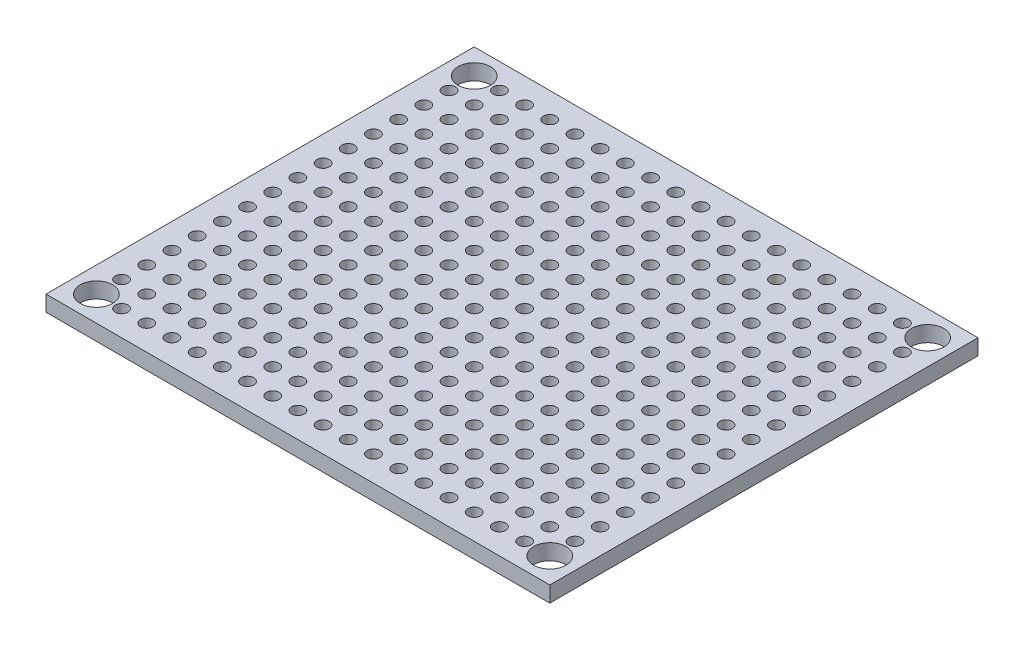
from build123d import *

# Parameters (mm, degrees)
SKETCH1_W             = 50.8
SKETCH1_H             = 43.18
BOSS_EXTRUDE1_DEPTH   = 1.5875
SKETCH2_R             = 0.635
CUT_EXTRUDE1_DEPTH    = 4.1275
F_4_CLEARANCE_HOLE1_D = 3.2639


with BuildPart() as part:
    # Sketch1 → Boss-Extrude1 (new body)
    with BuildSketch(Plane(origin=(0, 0, 0), x_dir=(1, 0, 0), z_dir=(0, 1, 0))):
        Rectangle(SKETCH1_W, SKETCH1_H)
    extrude(amount=BOSS_EXTRUDE1_DEPTH)

    # Sketch2 → Cut-Extrude1 (cut)
    with BuildSketch(Plane(origin=(0, 1.5875, 0), x_dir=(1, 0, 0), z_dir=(0, 1, 0))):
        with Locations((-22.86, -19.05)):
            Circle(SKETCH2_R)
        with Locations((-20.32, -19.05)):
            Circle(SKETCH2_R)
        with Locations((-17.78, -19.05)):
            Circle(SKETCH2_R)
        with Locations((-15.24, -19.05)):
            Circle(SKETCH2_R)
        with Locations((-12.7, -19.05)):
            Circle(SKETCH2_R)
        with Locations((-10.16, -19.05)):
            Circle(SKETCH2_R)
        with Locations((-7.62, -19.05)):
            Circle(SKETCH2_R)
        with Locations((-5.08, -19.05)):
            Circle(SKETCH2_R)
        with Locations((-2.54, -19.05)):
            Circle(SKETCH2_R)
        with Locations((0, -19.05)):
            Circle(SKETCH2_R)
        with Locations((2.54, -19.05)):
            Circle(SKETCH2_R)
        with Locations((5.08, -19.05)):
            Circle(SKETCH2_R)
        with Locations((7.62, -19.05)):
            Circle(SKETCH2_R)
        with Locations((10.16, -19.05)):
            Circle(SKETCH2_R)
        with Locations((12.7, -19.05)):
            Circle(SKETCH2_R)
        with Locations((15.24, -19.05)):
            Circle(SKETCH2_R)
        with Locations((17.78, -19.05)):
            Circle(SKETCH2_R)
        with Locations((20.32, -19.05)):
            Circle(SKETCH2_R)
        with Locations((22.86, -19.05)):
            Circle(SKETCH2_R)
        with Locations((-20.32, -16.51)):
            Circle(SKETCH2_R)
        with Locations((-17.78, -16.51)):
            Circle(SKETCH2_R)
        with Locations((-15.24, -16.51)):
            Circle(SKETCH2_R)
        with Locations((-12.7, -16.51)):
            Circle(SKETCH2_R)
        with Locations((-10.16, -16.51)):
            Circle(SKETCH2_R)
        with Locations((-7.62, -16.51)):
            Circle(SKETCH2_R)
        with Locations((-5.08, -16.51)):
            Circle(SKETCH2_R)
        with Locations((-2.54, -16.51)):
            Circle(SKETCH2_R)
        with Locations((0, -16.51)):
            Circle(SKETCH2_R)
        with Locations((2.54, -16.51)):
            Circle(SKETCH2_R)
        with Locations((5.08, -16.51)):
            Circle(SKETCH2_R)
        with Locations((7.62, -16.51)):
            Circle(SKETCH2_R)
        with Locations((10.16, -16.51)):
            Circle(SKETCH2_R)
        with Locations((12.7, -16.51)):
            Circle(SKETCH2_R)
        with Locations((15.24, -16.51)):
            Circle(SKETCH2_R)
        with Locations((17.78, -16.51)):
            Circle(SKETCH2_R)
        with Locations((20.32, -16.51)):
            Circle(SKETCH2_R)
        with Locations((22.86, -16.51)):
            Circle(SKETCH2_R)
        with Locations((-20.32, -13.97)):
            Circle(SKETCH2_R)
        with Locations((-17.78, -13.97)):
            Circle(SKETCH2_R)
        with Locations((-15.24, -13.97)):
            Circle(SKETCH2_R)
        with Locations((-12.7, -13.97)):
            Circle(SKETCH2_R)
        with Locations((-10.16, -13.97)):
            Circle(SKETCH2_R)
        with Locations((-7.62, -13.97)):
            Circle(SKETCH2_R)
        with Locations((-5.08, -13.97)):
            Circle(SKETCH2_R)
        with Locations((-2.54, -13.97)):
            Circle(SKETCH2_R)
        with Locations((0, -13.97)):
            Circle(SKETCH2_R)
        with Locations((2.54, -13.97)):
            Circle(SKETCH2_R)
        with Locations((5.08, -13.97)):
            Circle(SKETCH2_R)
        with Locations((7.62, -13.97)):
            Circle(SKETCH2_R)
        with Locations((10.16, -13.97)):
            Circle(SKETCH2_R)
        with Locations((12.7, -13.97)):
            Circle(SKETCH2_R)
        with Locations((15.24, -13.97)):
            Circle(SKETCH2_R)
        with Locations((17.78, -13.97)):
            Circle(SKETCH2_R)
        with Locations((20.32, -13.97)):
            Circle(SKETCH2_R)
        with Locations((22.86, -13.97)):
            Circle(SKETCH2_R)
        with Locations((-20.32, -11.43)):
            Circle(SKETCH2_R)
        with Locations((-17.78, -11.43)):
            Circle(SKETCH2_R)
        with Locations((-15.24, -11.43)):
            Circle(SKETCH2_R)
        with Locations((-12.7, -11.43)):
            Circle(SKETCH2_R)
        with Locations((-10.16, -11.43)):
            Circle(SKETCH2_R)
        with Locations((-7.62, -11.43)):
            Circle(SKETCH2_R)
        with Locations((-5.08, -11.43)):
            Circle(SKETCH2_R)
        with Locations((-2.54, -11.43)):
            Circle(SKETCH2_R)
        with Locations((0, -11.43)):
            Circle(SKETCH2_R)
        with Locations((2.54, -11.43)):
            Circle(SKETCH2_R)
        with Locations((5.08, -11.43)):
            Circle(SKETCH2_R)
        with Locations((7.62, -11.43)):
            Circle(SKETCH2_R)
        with Locations((10.16, -11.43)):
            Circle(SKETCH2_R)
        with Locations((12.7, -11.43)):
            Circle(SKETCH2_R)
        with Locations((15.24, -11.43)):
            Circle(SKETCH2_R)
        with Locations((17.78, -11.43)):
            Circle(SKETCH2_R)
        with Locations((20.32, -11.43)):
            Circle(SKETCH2_R)
        with Locations((22.86, -11.43)):
            Circle(SKETCH2_R)
        with Locations((-20.32, -8.89)):
            Circle(SKETCH2_R)
        with Locations((-17.78, -8.89)):
            Circle(SKETCH2_R)
        with Locations((-15.24, -8.89)):
            Circle(SKETCH2_R)
        with Locations((-12.7, -8.89)):
            Circle(SKETCH2_R)
        with Locations((-10.16, -8.89)):
            Circle(SKETCH2_R)
        with Locations((-7.62, -8.89)):
            Circle(SKETCH2_R)
        with Locations((-5.08, -8.89)):
            Circle(SKETCH2_R)
        with Locations((-2.54, -8.89)):
            Circle(SKETCH2_R)
        with Locations((0, -8.89)):
            Circle(SKETCH2_R)
        with Locations((2.54, -8.89)):
            Circle(SKETCH2_R)
        with Locations((5.08, -8.89)):
            Circle(SKETCH2_R)
        with Locations((7.62, -8.89)):
            Circle(SKETCH2_R)
        with Locations((10.16, -8.89)):
            Circle(SKETCH2_R)
        with Locations((12.7, -8.89)):
            Circle(SKETCH2_R)
        with Locations((15.24, -8.89)):
            Circle(SKETCH2_R)
        with Locations((17.78, -8.89)):
            Circle(SKETCH2_R)
        with Locations((20.32, -8.89)):
            Circle(SKETCH2_R)
        with Locations((22.86, -8.89)):
            Circle(SKETCH2_R)
        with Locations((-20.32, -6.35)):
            Circle(SKETCH2_R)
        with Locations((-17.78, -6.35)):
            Circle(SKETCH2_R)
        with Locations((-15.24, -6.35)):
            Circle(SKETCH2_R)
        with Locations((-12.7, -6.35)):
            Circle(SKETCH2_R)
        with Locations((-10.16, -6.35)):
            Circle(SKETCH2_R)
        with Locations((-7.62, -6.35)):
            Circle(SKETCH2_R)
        with Locations((-5.08, -6.35)):
            Circle(SKETCH2_R)
        with Locations((-2.54, -6.35)):
            Circle(SKETCH2_R)
        with Locations((0, -6.35)):
            Circle(SKETCH2_R)
        with Locations((2.54, -6.35)):
            Circle(SKETCH2_R)
        with Locations((5.08, -6.35)):
            Circle(SKETCH2_R)
        with Locations((7.62, -6.35)):
            Circle(SKETCH2_R)
        with Locations((10.16, -6.35)):
            Circle(SKETCH2_R)
        with Locations((12.7, -6.35)):
            Circle(SKETCH2_R)
        with Locations((15.24, -6.35)):
            Circle(SKETCH2_R)
        with Locations((17.78, -6.35)):
            Circle(SKETCH2_R)
        with Locations((20.32, -6.35)):
            Circle(SKETCH2_R)
        with Locations((22.86, -6.35)):
            Circle(SKETCH2_R)
        with Locations((-20.32, -3.81)):
            Circle(SKETCH2_R)
        with Locations((-17.78, -3.81)):
            Circle(SKETCH2_R)
        with Locations((-15.24, -3.81)):
            Circle(SKETCH2_R)
        with Locations((-12.7, -3.81)):
            Circle(SKETCH2_R)
        with Locations((-10.16, -3.81)):
            Circle(SKETCH2_R)
        with Locations((-7.62, -3.81)):
            Circle(SKETCH2_R)
        with Locations((-5.08, -3.81)):
            Circle(SKETCH2_R)
        with Locations((-2.54, -3.81)):
            Circle(SKETCH2_R)
        with Locations((0, -3.81)):
            Circle(SKETCH2_R)
        with Locations((2.54, -3.81)):
            Circle(SKETCH2_R)
        with Locations((5.08, -3.81)):
            Circle(SKETCH2_R)
        with Locations((7.62, -3.81)):
            Circle(SKETCH2_R)
        with Locations((10.16, -3.81)):
            Circle(SKETCH2_R)
        with Locations((12.7, -3.81)):
            Circle(SKETCH2_R)
        with Locations((15.24, -3.81)):
            Circle(SKETCH2_R)
        with Locations((17.78, -3.81)):
            Circle(SKETCH2_R)
        with Locations((20.32, -3.81)):
            Circle(SKETCH2_R)
        with Locations((22.86, -3.81)):
            Circle(SKETCH2_R)
        with Locations((-20.32, -1.27)):
            Circle(SKETCH2_R)
        with Locations((-17.78, -1.27)):
            Circle(SKETCH2_R)
        with Locations((-15.24, -1.27)):
            Circle(SKETCH2_R)
        with Locations((-12.7, -1.27)):
            Circle(SKETCH2_R)
        with Locations((-10.16, -1.27)):
            Circle(SKETCH2_R)
        with Locations((-7.62, -1.27)):
            Circle(SKETCH2_R)
        with Locations((-5.08, -1.27)):
            Circle(SKETCH2_R)
        with Locations((-2.54, -1.27)):
            Circle(SKETCH2_R)
        with Locations((0, -1.27)):
            Circle(SKETCH2_R)
        with Locations((2.54, -1.27)):
            Circle(SKETCH2_R)
        with Locations((5.08, -1.27)):
            Circle(SKETCH2_R)
        with Locations((7.62, -1.27)):
            Circle(SKETCH2_R)
        with Locations((10.16, -1.27)):
            Circle(SKETCH2_R)
        with Locations((12.7, -1.27)):
            Circle(SKETCH2_R)
        with Locations((15.24, -1.27)):
            Circle(SKETCH2_R)
        with Locations((17.78, -1.27)):
            Circle(SKETCH2_R)
        with Locations((20.32, -1.27)):
            Circle(SKETCH2_R)
        with Locations((22.86, -1.27)):
            Circle(SKETCH2_R)
        with Locations((-20.32, 1.27)):
            Circle(SKETCH2_R)
        with Locations((-17.78, 1.27)):
            Circle(SKETCH2_R)
        with Locations((-15.24, 1.27)):
            Circle(SKETCH2_R)
        with Locations((-12.7, 1.27)):
            Circle(SKETCH2_R)
        with Locations((-10.16, 1.27)):
            Circle(SKETCH2_R)
        with Locations((-7.62, 1.27)):
            Circle(SKETCH2_R)
        with Locations((-5.08, 1.27)):
            Circle(SKETCH2_R)
        with Locations((-2.54, 1.27)):
            Circle(SKETCH2_R)
        with Locations((0, 1.27)):
            Circle(SKETCH2_R)
        with Locations((2.54, 1.27)):
            Circle(SKETCH2_R)
        with Locations((5.08, 1.27)):
            Circle(SKETCH2_R)
        with Locations((7.62, 1.27)):
            Circle(SKETCH2_R)
        with Locations((10.16, 1.27)):
            Circle(SKETCH2_R)
        with Locations((12.7, 1.27)):
            Circle(SKETCH2_R)
        with Locations((15.24, 1.27)):
            Circle(SKETCH2_R)
        with Locations((17.78, 1.27)):
            Circle(SKETCH2_R)
        with Locations((20.32, 1.27)):
            Circle(SKETCH2_R)
        with Locations((22.86, 1.27)):
            Circle(SKETCH2_R)
        with Locations((-20.32, 3.81)):
            Circle(SKETCH2_R)
        with Locations((-17.78, 3.81)):
            Circle(SKETCH2_R)
        with Locations((-15.24, 3.81)):
            Circle(SKETCH2_R)
        with Locations((-12.7, 3.81)):
            Circle(SKETCH2_R)
        with Locations((-10.16, 3.81)):
            Circle(SKETCH2_R)
        with Locations((-7.62, 3.81)):
            Circle(SKETCH2_R)
        with Locations((-5.08, 3.81)):
            Circle(SKETCH2_R)
        with Locations((-2.54, 3.81)):
            Circle(SKETCH2_R)
        with Locations((0, 3.81)):
            Circle(SKETCH2_R)
        with Locations((2.54, 3.81)):
            Circle(SKETCH2_R)
        with Locations((5.08, 3.81)):
            Circle(SKETCH2_R)
        with Locations((7.62, 3.81)):
            Circle(SKETCH2_R)
        with Locations((10.16, 3.81)):
            Circle(SKETCH2_R)
        with Locations((12.7, 3.81)):
            Circle(SKETCH2_R)
        with Locations((15.24, 3.81)):
            Circle(SKETCH2_R)
        with Locations((17.78, 3.81)):
            Circle(SKETCH2_R)
        with Locations((20.32, 3.81)):
            Circle(SKETCH2_R)
        with Locations((22.86, 3.81)):
            Circle(SKETCH2_R)
        with Locations((-20.32, 6.35)):
            Circle(SKETCH2_R)
        with Locations((-17.78, 6.35)):
            Circle(SKETCH2_R)
        with Locations((-15.24, 6.35)):
            Circle(SKETCH2_R)
        with Locations((-12.7, 6.35)):
            Circle(SKETCH2_R)
        with Locations((-10.16, 6.35)):
            Circle(SKETCH2_R)
        with Locations((-7.62, 6.35)):
            Circle(SKETCH2_R)
        with Locations((-5.08, 6.35)):
            Circle(SKETCH2_R)
        with Locations((-2.54, 6.35)):
            Circle(SKETCH2_R)
        with Locations((0, 6.35)):
            Circle(SKETCH2_R)
        with Locations((2.54, 6.35)):
            Circle(SKETCH2_R)
        with Locations((5.08, 6.35)):
            Circle(SKETCH2_R)
        with Locations((7.62, 6.35)):
            Circle(SKETCH2_R)
        with Locations((10.16, 6.35)):
            Circle(SKETCH2_R)
        with Locations((12.7, 6.35)):
            Circle(SKETCH2_R)
        with Locations((15.24, 6.35)):
            Circle(SKETCH2_R)
        with Locations((17.78, 6.35)):
            Circle(SKETCH2_R)
        with Locations((20.32, 6.35)):
            Circle(SKETCH2_R)
        with Locations((22.86, 6.35)):
            Circle(SKETCH2_R)
        with Locations((-20.32, 8.89)):
            Circle(SKETCH2_R)
        with Locations((-17.78, 8.89)):
            Circle(SKETCH2_R)
        with Locations((-15.24, 8.89)):
            Circle(SKETCH2_R)
        with Locations((-12.7, 8.89)):
            Circle(SKETCH2_R)
        with Locations((-10.16, 8.89)):
            Circle(SKETCH2_R)
        with Locations((-7.62, 8.89)):
            Circle(SKETCH2_R)
        with Locations((-5.08, 8.89)):
            Circle(SKETCH2_R)
        with Locations((-2.54, 8.89)):
            Circle(SKETCH2_R)
        with Locations((0, 8.89)):
            Circle(SKETCH2_R)
        with Locations((2.54, 8.89)):
            Circle(SKETCH2_R)
        with Locations((5.08, 8.89)):
            Circle(SKETCH2_R)
        with Locations((7.62, 8.89)):
            Circle(SKETCH2_R)
        with Locations((10.16, 8.89)):
            Circle(SKETCH2_R)
        with Locations((12.7, 8.89)):
            Circle(SKETCH2_R)
        with Locations((15.24, 8.89)):
            Circle(SKETCH2_R)
        with Locations((17.78, 8.89)):
            Circle(SKETCH2_R)
        with Locations((20.32, 8.89)):
            Circle(SKETCH2_R)
        with Locations((22.86, 8.89)):
            Circle(SKETCH2_R)
        with Locations((-20.32, 11.43)):
            Circle(SKETCH2_R)
        with Locations((-17.78, 11.43)):
            Circle(SKETCH2_R)
        with Locations((-15.24, 11.43)):
            Circle(SKETCH2_R)
        with Locations((-12.7, 11.43)):
            Circle(SKETCH2_R)
        with Locations((-10.16, 11.43)):
            Circle(SKETCH2_R)
        with Locations((-7.62, 11.43)):
            Circle(SKETCH2_R)
        with Locations((-5.08, 11.43)):
            Circle(SKETCH2_R)
        with Locations((-2.54, 11.43)):
            Circle(SKETCH2_R)
        with Locations((0, 11.43)):
            Circle(SKETCH2_R)
        with Locations((2.54, 11.43)):
            Circle(SKETCH2_R)
        with Locations((5.08, 11.43)):
            Circle(SKETCH2_R)
        with Locations((7.62, 11.43)):
            Circle(SKETCH2_R)
        with Locations((10.16, 11.43)):
            Circle(SKETCH2_R)
        with Locations((12.7, 11.43)):
            Circle(SKETCH2_R)
        with Locations((15.24, 11.43)):
            Circle(SKETCH2_R)
        with Locations((17.78, 11.43)):
            Circle(SKETCH2_R)
        with Locations((20.32, 11.43)):
            Circle(SKETCH2_R)
        with Locations((22.86, 11.43)):
            Circle(SKETCH2_R)
        with Locations((-20.32, 13.97)):
            Circle(SKETCH2_R)
        with Locations((-17.78, 13.97)):
            Circle(SKETCH2_R)
        with Locations((-15.24, 13.97)):
            Circle(SKETCH2_R)
        with Locations((-12.7, 13.97)):
            Circle(SKETCH2_R)
        with Locations((-10.16, 13.97)):
            Circle(SKETCH2_R)
        with Locations((-7.62, 13.97)):
            Circle(SKETCH2_R)
        with Locations((-5.08, 13.97)):
            Circle(SKETCH2_R)
        with Locations((-2.54, 13.97)):
            Circle(SKETCH2_R)
        with Locations((0, 13.97)):
            Circle(SKETCH2_R)
        with Locations((2.54, 13.97)):
            Circle(SKETCH2_R)
        with Locations((5.08, 13.97)):
            Circle(SKETCH2_R)
        with Locations((7.62, 13.97)):
            Circle(SKETCH2_R)
        with Locations((10.16, 13.97)):
            Circle(SKETCH2_R)
        with Locations((12.7, 13.97)):
            Circle(SKETCH2_R)
        with Locations((15.24, 13.97)):
            Circle(SKETCH2_R)
        with Locations((17.78, 13.97)):
            Circle(SKETCH2_R)
        with Locations((20.32, 13.97)):
            Circle(SKETCH2_R)
        with Locations((22.86, 13.97)):
            Circle(SKETCH2_R)
        with Locations((-20.32, 16.51)):
            Circle(SKETCH2_R)
        with Locations((-17.78, 16.51)):
            Circle(SKETCH2_R)
        with Locations((-15.24, 16.51)):
            Circle(SKETCH2_R)
        with Locations((-12.7, 16.51)):
            Circle(SKETCH2_R)
        with Locations((-10.16, 16.51)):
            Circle(SKETCH2_R)
        with Locations((-7.62, 16.51)):
            Circle(SKETCH2_R)
        with Locations((-5.08, 16.51)):
            Circle(SKETCH2_R)
        with Locations((-2.54, 16.51)):
            Circle(SKETCH2_R)
        with Locations((0, 16.51)):
            Circle(SKETCH2_R)
        with Locations((2.54, 16.51)):
            Circle(SKETCH2_R)
        with Locations((5.08, 16.51)):
            Circle(SKETCH2_R)
        with Locations((7.62, 16.51)):
            Circle(SKETCH2_R)
        with Locations((10.16, 16.51)):
            Circle(SKETCH2_R)
        with Locations((12.7, 16.51)):
            Circle(SKETCH2_R)
        with Locations((15.24, 16.51)):
            Circle(SKETCH2_R)
        with Locations((17.78, 16.51)):
            Circle(SKETCH2_R)
        with Locations((20.32, 16.51)):
            Circle(SKETCH2_R)
        with Locations((22.86, 16.51)):
            Circle(SKETCH2_R)
        with Locations((-20.32, 19.05)):
            Circle(SKETCH2_R)
        with Locations((-17.78, 19.05)):
            Circle(SKETCH2_R)
        with Locations((-15.24, 19.05)):
            Circle(SKETCH2_R)
        with Locations((-12.7, 19.05)):
            Circle(SKETCH2_R)
        with Locations((-10.16, 19.05)):
            Circle(SKETCH2_R)
        with Locations((-7.62, 19.05)):
            Circle(SKETCH2_R)
        with Locations((-5.08, 19.05)):
            Circle(SKETCH2_R)
        with Locations((-2.54, 19.05)):
            Circle(SKETCH2_R)
        with Locations((0, 19.05)):
            Circle(SKETCH2_R)
        with Locations((2.54, 19.05)):
            Circle(SKETCH2_R)
        with Locations((5.08, 19.05)):
            Circle(SKETCH2_R)
        with Locations((7.62, 19.05)):
            Circle(SKETCH2_R)
        with Locations((10.16, 19.05)):
            Circle(SKETCH2_R)
        with Locations((12.7, 19.05)):
            Circle(SKETCH2_R)
        with Locations((15.24, 19.05)):
            Circle(SKETCH2_R)
        with Locations((17.78, 19.05)):
            Circle(SKETCH2_R)
        with Locations((20.32, 19.05)):
            Circle(SKETCH2_R)
        with Locations((22.86, 19.05)):
            Circle(SKETCH2_R)
        with Locations((-22.86, -16.51)):
            Circle(SKETCH2_R)
        with Locations((-22.86, -13.97)):
            Circle(SKETCH2_R)
        with Locations((-22.86, -11.43)):
            Circle(SKETCH2_R)
        with Locations((-22.86, -8.89)):
            Circle(SKETCH2_R)
        with Locations((-22.86, -6.35)):
            Circle(SKETCH2_R)
        with Locations((-22.86, -3.81)):
            Circle(SKETCH2_R)
        with Locations((-22.86, -1.27)):
            Circle(SKETCH2_R)
        with Locations((-22.86, 1.27)):
            Circle(SKETCH2_R)
        with Locations((-22.86, 3.81)):
            Circle(SKETCH2_R)
        with Locations((-22.86, 6.35)):
            Circle(SKETCH2_R)
        with Locations((-22.86, 8.89)):
            Circle(SKETCH2_R)
        with Locations((-22.86, 11.43)):
            Circle(SKETCH2_R)
        with Locations((-22.86, 13.97)):
            Circle(SKETCH2_R)
        with Locations((-22.86, 16.51)):
            Circle(SKETCH2_R)
        with Locations((-22.86, 19.05)):
            Circle(SKETCH2_R)
    extrude(amount=-CUT_EXTRUDE1_DEPTH, mode=Mode.SUBTRACT)

    # #4 Clearance Hole1 (through all)
    with Locations(Plane(origin=(0, 1.5875, 0), x_dir=(1, 0, 0), z_dir=(0, 1, 0))):
        with Locations((-22.86, -19.05), (22.86, -19.05), (-22.86, 19.05), (22.86, 19.05)):
            Hole(F_4_CLEARANCE_HOLE1_D / 2)


solid = part.part
